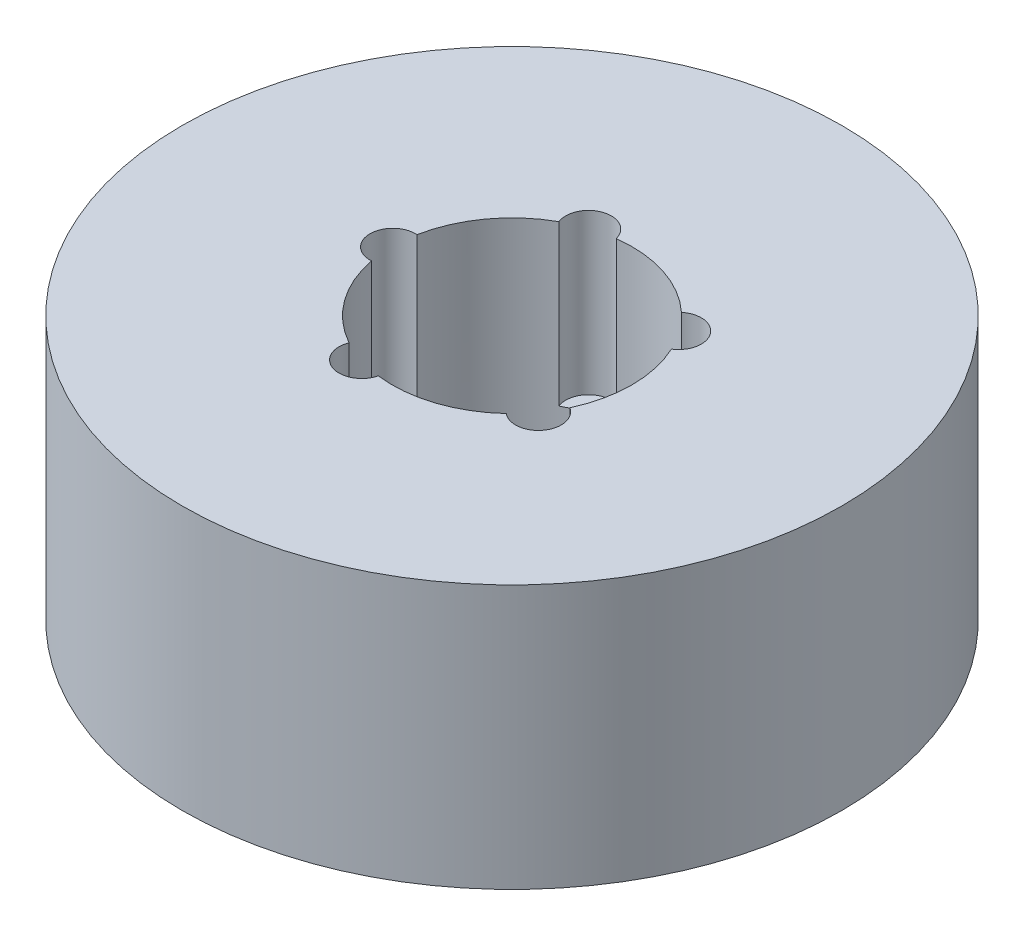
from build123d import *

# Parameters (mm, degrees)
SKETCH1_R           = 27.5
BOSS_EXTRUDE1_DEPTH = 22
SKETCH2_R           = 10
CUT_EXTRUDE1_DEPTH  = 45.682211225
SKETCH3_R           = 1.902397457
CUT_EXTRUDE2_DEPTH  = 13.316909701
CIRPATTERN1_COUNT   = 5


with BuildPart() as part:
    # Sketch1 → Boss-Extrude1 (new body)
    with BuildSketch(Plane(origin=(0, 0, 0), x_dir=(1, 0, 0), z_dir=(0, 1, 0))):
        Circle(SKETCH1_R)
    extrude(amount=BOSS_EXTRUDE1_DEPTH)

    # Sketch2 → Cut-Extrude1 (cut, through all)
    with BuildSketch(Plane(origin=(0, 0, 0), x_dir=(1, 0, 0), z_dir=(0, 1, 0))):
        Circle(SKETCH2_R)
    extrude(amount=CUT_EXTRUDE1_DEPTH, mode=Mode.SUBTRACT)

    # Sketch3 → Cut-Extrude2 (cut)
    with BuildSketch(Plane(origin=(0, 22, 0), x_dir=(1, 0, 0), z_dir=(0, 1, 0))):
        with Locations((-9.94279823, 0)):
            Circle(SKETCH3_R)
    cut_extrude2 = extrude(amount=-CUT_EXTRUDE2_DEPTH, mode=Mode.SUBTRACT)

    # CirPattern1: Cut-Extrude2 ×5 about axis
    cirpattern1_axis = Axis((0, 0, 0), (0, 1, 0))
    for i in range(1, CIRPATTERN1_COUNT):
        add(cut_extrude2.rotate(cirpattern1_axis, i * 360 / CIRPATTERN1_COUNT), mode=Mode.SUBTRACT)


solid = part.part
